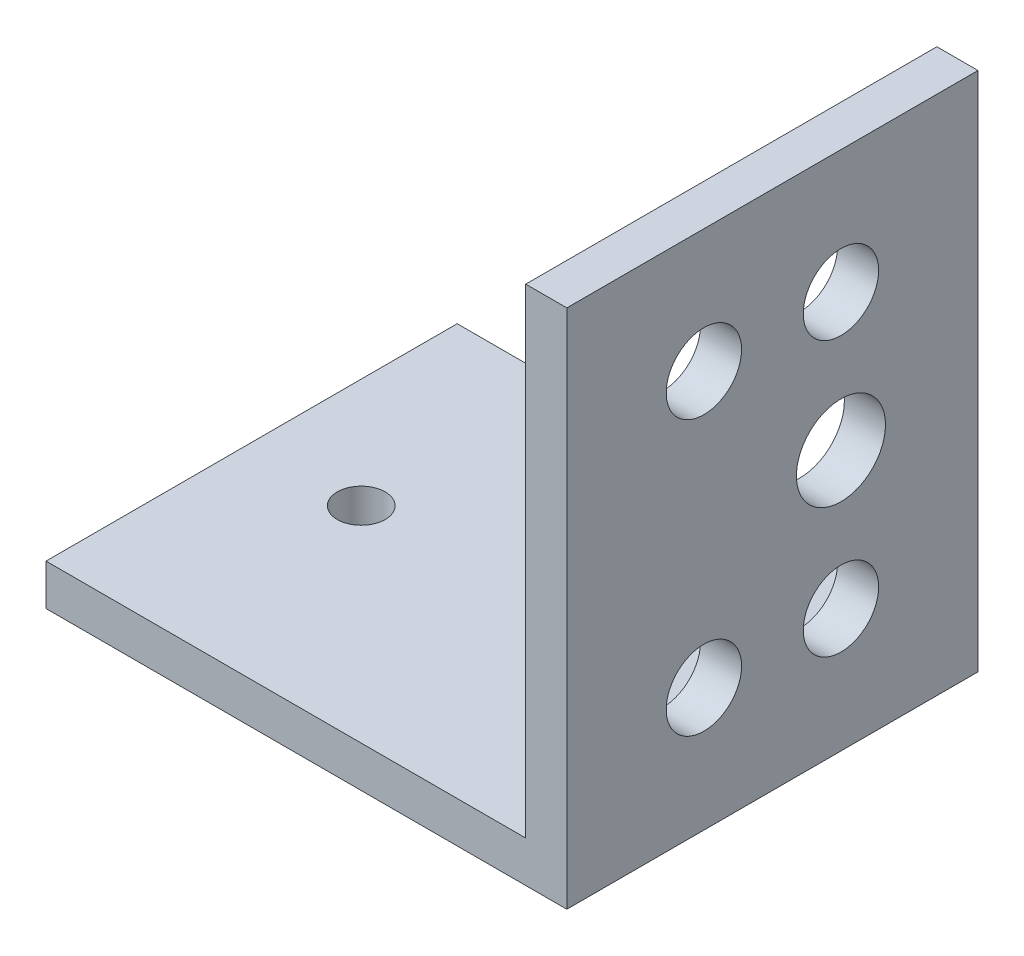
from build123d import *

# Parameters (mm, degrees)
EXTRUDE_1_DEPTH     = 30
SKETCH_3_R          = 1.75
CUT_EXTRUDE_2_DEPTH = 10
CUT_EXTRUDE_3_REACH = 63.547
SKETCH_4_R          = 2.75
SKETCH_4_R_2        = 3.25


with BuildPart() as part:
    # 草图1 → 凸台-拉伸1 (new body)
    with BuildSketch(Plane.XY):
        Polygon((0, 0), (0, 38), (-3, 38), (-3, 3), (-38, 3), (-38, 0), align=None)
    extrude(amount=EXTRUDE_1_DEPTH)

    # 草图3 → 切除-拉伸2 (cut)
    with BuildSketch(Plane(origin=(0, 3, 0), x_dir=(1, 0, 0), z_dir=(0, 1, 0))):
        with Locations((-30, -15)):
            Circle(SKETCH_3_R)
        with Locations((-10.039465431, -16.255810391)):
            Circle(SKETCH_3_R)
    extrude(amount=-CUT_EXTRUDE_2_DEPTH, mode=Mode.SUBTRACT)

    # 草图4 → 切除-拉伸3 (cut, up to next)
    with BuildSketch(Plane(origin=(0, 0, 0), x_dir=(0, 0, -1), z_dir=(1, 0, 0)), mode=Mode.PRIVATE) as cut_extrude_3_sk1:
        with Locations((-10, 29)):
            Circle(SKETCH_4_R)
    cut_extrude_3_tool1 = extrude(cut_extrude_3_sk1.sketch, amount=-CUT_EXTRUDE_3_REACH, mode=Mode.PRIVATE) & part.part
    # 草图4 → 切除-拉伸3 (cut, up to next)
    with BuildSketch(Plane(origin=(0, 0, 0), x_dir=(0, 0, -1), z_dir=(1, 0, 0)), mode=Mode.PRIVATE) as cut_extrude_3_sk2:
        with Locations((-10, 19)):
            Circle(SKETCH_4_R_2)
    cut_extrude_3_tool2 = extrude(cut_extrude_3_sk2.sketch, amount=-CUT_EXTRUDE_3_REACH, mode=Mode.PRIVATE) & part.part
    # 草图4 → 切除-拉伸3 (cut, up to next)
    with BuildSketch(Plane(origin=(0, 0, 0), x_dir=(0, 0, -1), z_dir=(1, 0, 0)), mode=Mode.PRIVATE) as cut_extrude_3_sk3:
        with Locations((-10, 9)):
            Circle(SKETCH_4_R)
    cut_extrude_3_tool3 = extrude(cut_extrude_3_sk3.sketch, amount=-CUT_EXTRUDE_3_REACH, mode=Mode.PRIVATE) & part.part
    # 草图4 → 切除-拉伸3 (cut, up to next)
    with BuildSketch(Plane(origin=(0, 0, 0), x_dir=(0, 0, -1), z_dir=(1, 0, 0)), mode=Mode.PRIVATE) as cut_extrude_3_sk4:
        with Locations((-20, 29)):
            Circle(SKETCH_4_R)
    cut_extrude_3_tool4 = extrude(cut_extrude_3_sk4.sketch, amount=-CUT_EXTRUDE_3_REACH, mode=Mode.PRIVATE) & part.part
    # 草图4 → 切除-拉伸3 (cut, up to next)
    with BuildSketch(Plane(origin=(0, 0, 0), x_dir=(0, 0, -1), z_dir=(1, 0, 0)), mode=Mode.PRIVATE) as cut_extrude_3_sk5:
        with Locations((-20, 9)):
            Circle(SKETCH_4_R)
    cut_extrude_3_tool5 = extrude(cut_extrude_3_sk5.sketch, amount=-CUT_EXTRUDE_3_REACH, mode=Mode.PRIVATE) & part.part
    add(cut_extrude_3_tool1.solids().sort_by_distance((0, 29, 10))[0], mode=Mode.SUBTRACT)
    add(cut_extrude_3_tool2.solids().sort_by_distance((0, 19, 10))[0], mode=Mode.SUBTRACT)
    add(cut_extrude_3_tool3.solids().sort_by_distance((0, 9, 10))[0], mode=Mode.SUBTRACT)
    add(cut_extrude_3_tool4.solids().sort_by_distance((0, 29, 20))[0], mode=Mode.SUBTRACT)
    add(cut_extrude_3_tool5.solids().sort_by_distance((0, 9, 20))[0], mode=Mode.SUBTRACT)


solid = part.part
